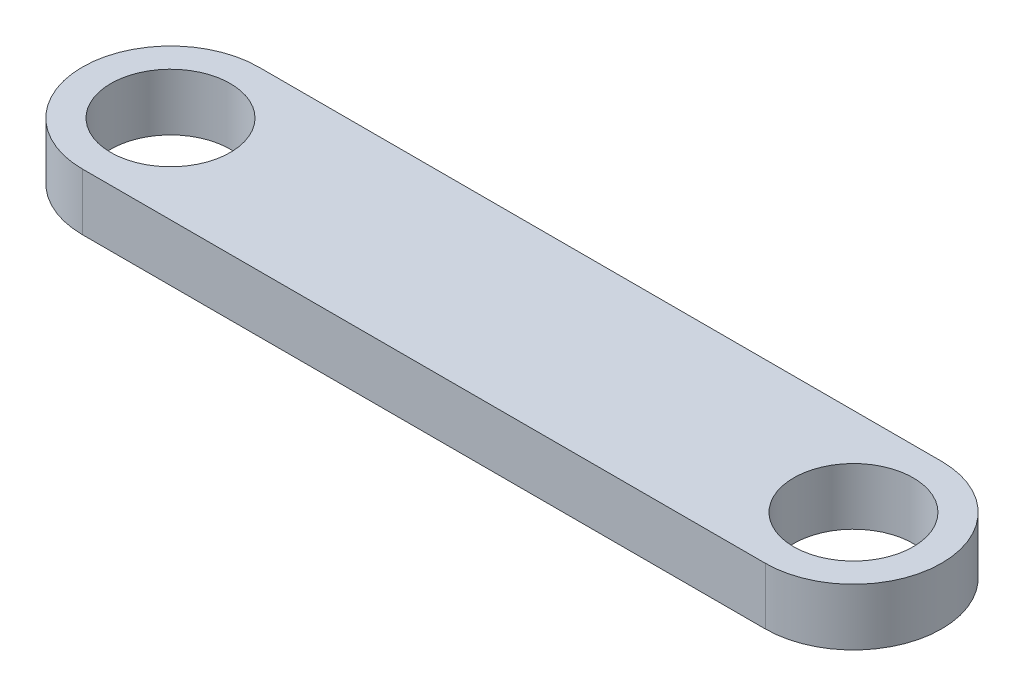
from build123d import *

# Parameters (mm, degrees)
SKETCH1_R           = 2.667
BOSS_EXTRUDE1_DEPTH = 2.54


with BuildPart() as part:
    # Sketch1 → Boss-Extrude1 (new body)
    with BuildSketch(Plane(origin=(0, 0, 0), x_dir=(1, 0, 0), z_dir=(0, 1, 0))):
        with BuildLine():
            Line((0, 3.937), (30.48, 3.937))
            ThreePointArc((30.48, 3.937), (34.417, 0), (30.48, -3.937))
            Line((30.48, -3.937), (0, -3.937))
            ThreePointArc((0, -3.937), (-3.937, 0), (0, 3.937))
        make_face()
        Circle(SKETCH1_R, mode=Mode.SUBTRACT)
        with Locations((30.48, 0)):
            Circle(SKETCH1_R, mode=Mode.SUBTRACT)
    extrude(amount=BOSS_EXTRUDE1_DEPTH)


solid = part.part
